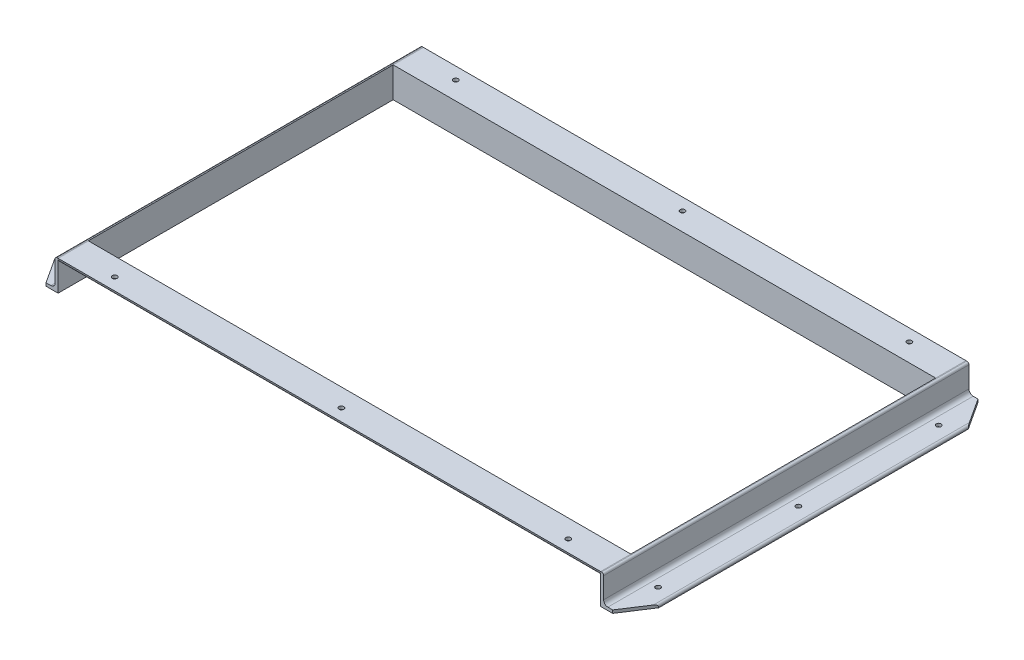
from build123d import *

# Parameters (mm, degrees)
L_START                    = -448.5
L_ANGLE_L50X50X5_1_DEPTH   = 897
L_START_2                  = -302.01
L_ANGLE_L50X50X5_1_2_DEPTH = 604.02
CUT_EXTRUDE1_DEPTH         = 585.583005312
SKETCH13_R                 = 4
CUT_EXTRUDE2_DEPTH         = 585.583005312
SKETCH14_R                 = 4
CUT_EXTRUDE3_DEPTH         = 10


# Read off the part's stored shape, not the designer's step: L angle L50X50X5(1)
with BuildPart() as part:
    # L angle L50X50X5(1) outline → L angle L50X50X5(1) (new body)
    with BuildSketch(Plane.YZ.offset(L_START)):
        with BuildLine():
            Line((25, 252.01), (25, 302.01))
            Line((25, 302.01), (23.5, 302.01))
            ThreePointArc((23.5, 302.01), (21.025126266, 300.984873734), (20, 298.51))
            Line((20, 298.51), (20, 264.01))
            ThreePointArc((20, 264.01), (17.949747468, 259.060252532), (13, 257.01))
            Line((13, 257.01), (-21.5, 257.01))
            ThreePointArc((-21.5, 257.01), (-23.974873734, 255.984873734), (-25, 253.51))
            Line((-25, 253.51), (-25, 252.01))
            Line((-25, 252.01), (25, 252.01))
        make_face()
        with BuildLine():
            Line((25, -252.01), (-25, -252.01))
            Line((-25, -252.01), (-25, -253.51))
            ThreePointArc((-25, -253.51), (-23.974873734, -255.984873734), (-21.5, -257.01))
            Line((-21.5, -257.01), (13, -257.01))
            ThreePointArc((13, -257.01), (17.949747468, -259.060252532), (20, -264.01))
            Line((20, -264.01), (20, -298.51))
            ThreePointArc((20, -298.51), (21.025126266, -300.984873734), (23.5, -302.01))
            Line((23.5, -302.01), (25, -302.01))
            Line((25, -302.01), (25, -252.01))
        make_face()
    extrude(amount=L_ANGLE_L50X50X5_1_DEPTH)

    # Sketch14 → Cut-Extrude3 (cut)
    with BuildSketch(Plane(origin=(0, 25, 0), x_dir=(1, 0, 0), z_dir=(0, 1, 0))):
        with Locations(Location((375, 282.01, 0), (0, 0, 270))):
            Circle(SKETCH14_R)
        with Locations(Location((0, 282.01, 0), (0, 0, 270))):
            Circle(SKETCH14_R)
        with Locations(Location((-375, 282.01, 0), (0, 0, 270))):
            Circle(SKETCH14_R)
        with Locations(Location((-375, -282.01, 0), (0, 0, 270))):
            Circle(SKETCH14_R)
        with Locations(Location((0, -282.01, 0), (0, 0, 270))):
            Circle(SKETCH14_R)
        with Locations(Location((375, -282.01, 0), (0, 0, 270))):
            Circle(SKETCH14_R)
    extrude(amount=-CUT_EXTRUDE3_DEPTH, mode=Mode.SUBTRACT)


with BuildPart() as body_2:
    # L angle L50X50X5_1 2 outline → L angle L50X50X5_1 2 (new body)
    with BuildSketch(Plane.XY.offset(L_START_2)):
        with BuildLine():
            Line((448.5, -25), (498.5, -25))
            Line((498.5, -25), (498.5, -23.5))
            ThreePointArc((498.5, -23.5), (497.474873734, -21.025126266), (495, -20))
            Line((495, -20), (460.5, -20))
            ThreePointArc((460.5, -20), (455.550252532, -17.949747468), (453.5, -13))
            Line((453.5, -13), (453.5, 21.5))
            ThreePointArc((453.5, 21.5), (452.474873734, 23.974873734), (450, 25))
            Line((450, 25), (448.5, 25))
            Line((448.5, 25), (448.5, -25))
        make_face()
        with BuildLine():
            Line((-448.5, -25), (-448.5, 25))
            Line((-448.5, 25), (-450, 25))
            ThreePointArc((-450, 25), (-452.474873734, 23.974873734), (-453.5, 21.5))
            Line((-453.5, 21.5), (-453.5, -13))
            ThreePointArc((-453.5, -13), (-455.550252532, -17.949747468), (-460.5, -20))
            Line((-460.5, -20), (-495, -20))
            ThreePointArc((-495, -20), (-497.474873734, -21.025126266), (-498.5, -23.5))
            Line((-498.5, -23.5), (-498.5, -25))
            Line((-498.5, -25), (-448.5, -25))
        make_face()
    extrude(amount=L_ANGLE_L50X50X5_1_2_DEPTH)

    # Sketch12 → Cut-Extrude1 (cut, through all)
    with BuildSketch(Plane(origin=(0, -20, 0), x_dir=(1, 0, 0), z_dir=(0, 1, 0))):
        Polygon((-468.5, -302.01), (-500.831260031, -252.33008513), (-500.831260031, -302.01), align=None)
        Polygon((-500.831260031, 302.01), (-500.831260031, 252.33008513), (-468.5, 302.01), align=None)
        Polygon((468.5, 302.01), (500.831260031, 252.33008513), (500.831260031, 302.01), align=None)
        Polygon((500.831260031, -302.01), (500.831260031, -252.33008513), (468.5, -302.01), align=None)
    extrude(amount=-CUT_EXTRUDE1_DEPTH, mode=Mode.SUBTRACT)

    # Sketch13 → Cut-Extrude2 (cut, through all)
    with BuildSketch(Plane(origin=(0, -20, 0), x_dir=(1, 0, 0), z_dir=(0, 1, 0))):
        with Locations(Location((-473.5, -232.01, 0), (0, 0, 180))):
            Circle(SKETCH13_R)
        with Locations(Location((-473.5, -0.01, 0), (0, 0, 180))):
            Circle(SKETCH13_R)
        with Locations(Location((-473.5, 231.99, 0), (0, 0, 180))):
            Circle(SKETCH13_R)
        with Locations((473.5, 231.99)):
            Circle(SKETCH13_R)
        with Locations((473.5, -0.01)):
            Circle(SKETCH13_R)
        with Locations((473.5, -232.01)):
            Circle(SKETCH13_R)
    extrude(amount=-CUT_EXTRUDE2_DEPTH, mode=Mode.SUBTRACT)


solid = Compound([part.part, body_2.part])
